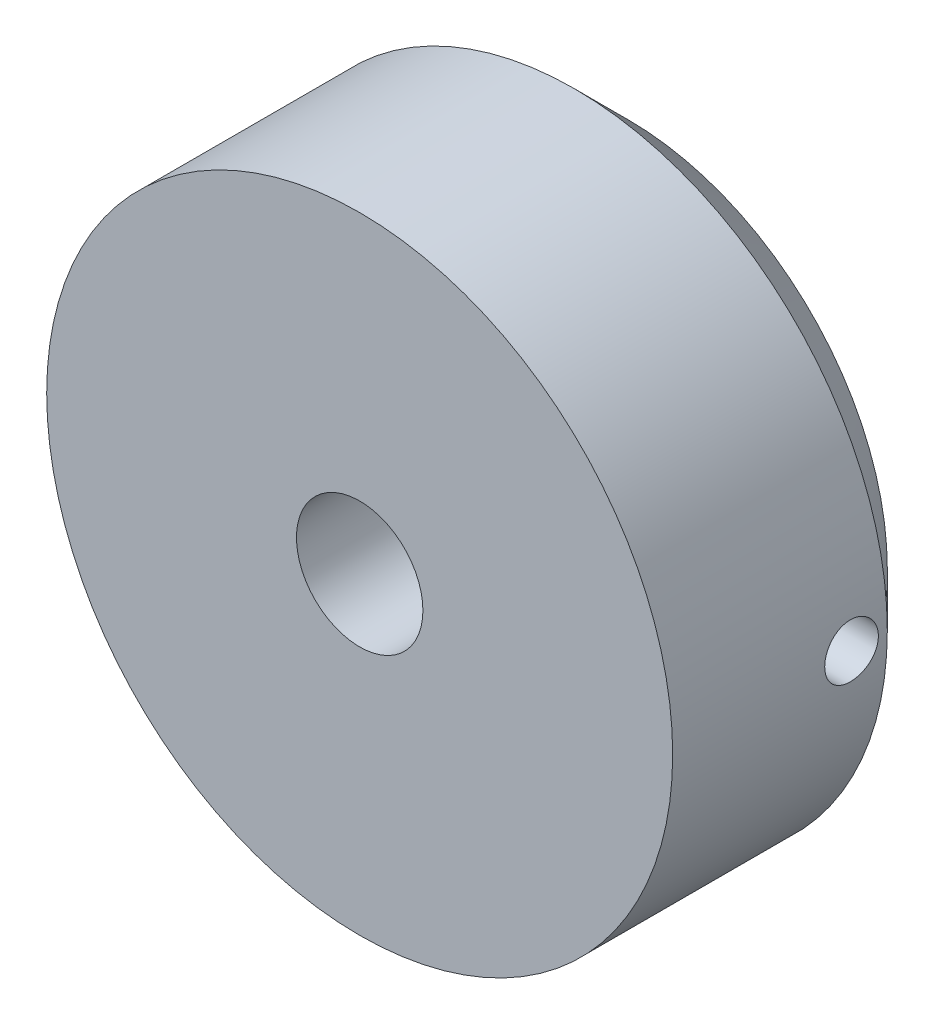
from build123d import *

# Parameters (mm, degrees)
BOSS_EXTRUDE1_DEPTH             = 10
BOSS_EXTRUDE1_DEPTH_BACK        = 5
SKETCH1_R                       = 17.5
SKETCH1_R_2                     = 3.535
SKETCH2_R                       = 1.5
CUT_EXTRUDE1_DEPTH              = 27.69269563
SKETCH3_R                       = 1.5
CUT_EXTRUDE2_DEPTH              = 27.692695815
CHAMFER1_SIZE                   = 3
BOSS_EXTRUDE2_REACH             = 28.693
SKETCH4_R                       = 11.5
SKETCH4_R_2                     = 3.535
BOSS_EXTRUDE2_DIRECTION_2_REACH = 28.693


with BuildPart() as part:
    # Sketch1 → Boss-Extrude1 (new, two sides: drawn at the far end of the back side and taken through both)
    with BuildSketch(Plane.XY.offset(-BOSS_EXTRUDE1_DEPTH_BACK)):
        Circle(SKETCH1_R)
        Circle(SKETCH1_R_2, mode=Mode.SUBTRACT)
    extrude(amount=BOSS_EXTRUDE1_DEPTH + BOSS_EXTRUDE1_DEPTH_BACK)

    # Sketch2 → Cut-Extrude1 (cut, through all)
    with BuildSketch(Plane(origin=(0, 0, 0), x_dir=(1, 0, 0), z_dir=(0, 1, 0))):
        Circle(SKETCH2_R)
    extrude(amount=-CUT_EXTRUDE1_DEPTH, mode=Mode.SUBTRACT)

    # Sketch3 → Cut-Extrude2 (cut, through all)
    with BuildSketch(Plane(origin=(0, 0, 0), x_dir=(0, 0, -1), z_dir=(1, 0, 0))):
        Circle(SKETCH3_R)
    extrude(amount=CUT_EXTRUDE2_DEPTH, mode=Mode.SUBTRACT)

    # Chamfer1
    chamfer1_edges = [part.edges().sort_by_distance(p)[0] for p in [
        (-17.5, 0, -5),
    ]]
    chamfer(chamfer1_edges, length=CHAMFER1_SIZE)

    # Boss-Extrude2: up to this face of the body (flat: up to its plane)
    boss_extrude2_end = Plane(part.part.faces().sort_by_distance((-17.005025253, 0, 10))[0])
    # Sketch4 → Boss-Extrude2 (add, up to the picked face)
    with BuildSketch(Plane.XY, mode=Mode.PRIVATE) as boss_extrude2_sk1:
        Circle(SKETCH4_R)
        Circle(SKETCH4_R_2, mode=Mode.SUBTRACT)
    boss_extrude2_tool1 = split(extrude(boss_extrude2_sk1.sketch, amount=BOSS_EXTRUDE2_REACH, mode=Mode.PRIVATE), bisect_by=boss_extrude2_end, keep=Keep.BOTH, mode=Mode.PRIVATE)
    add(boss_extrude2_tool1.solids().sort_by(Axis((-11.174731, 0, 0), (0, 0, 1)))[0])

    # Boss-Extrude2 direction 2: up to this face of the body (flat: up to its plane)
    boss_extrude2_direction_2_end = Plane(part.part.faces().sort_by_distance((-14.089878067, 0, -5))[0])
    # Sketch4 → Boss-Extrude2 direction 2 (add, up to the picked face)
    with BuildSketch(Plane.XY, mode=Mode.PRIVATE) as boss_extrude2_direction_2_sk1:
        Circle(SKETCH4_R)
        Circle(SKETCH4_R_2, mode=Mode.SUBTRACT)
    boss_extrude2_direction_2_tool1 = split(extrude(boss_extrude2_direction_2_sk1.sketch, amount=-BOSS_EXTRUDE2_DIRECTION_2_REACH, mode=Mode.PRIVATE), bisect_by=boss_extrude2_direction_2_end, keep=Keep.BOTH, mode=Mode.PRIVATE)
    add(boss_extrude2_direction_2_tool1.solids().sort_by(Axis((-11.174731, 0, 0), (0, 0, -1)))[0])


solid = part.part
